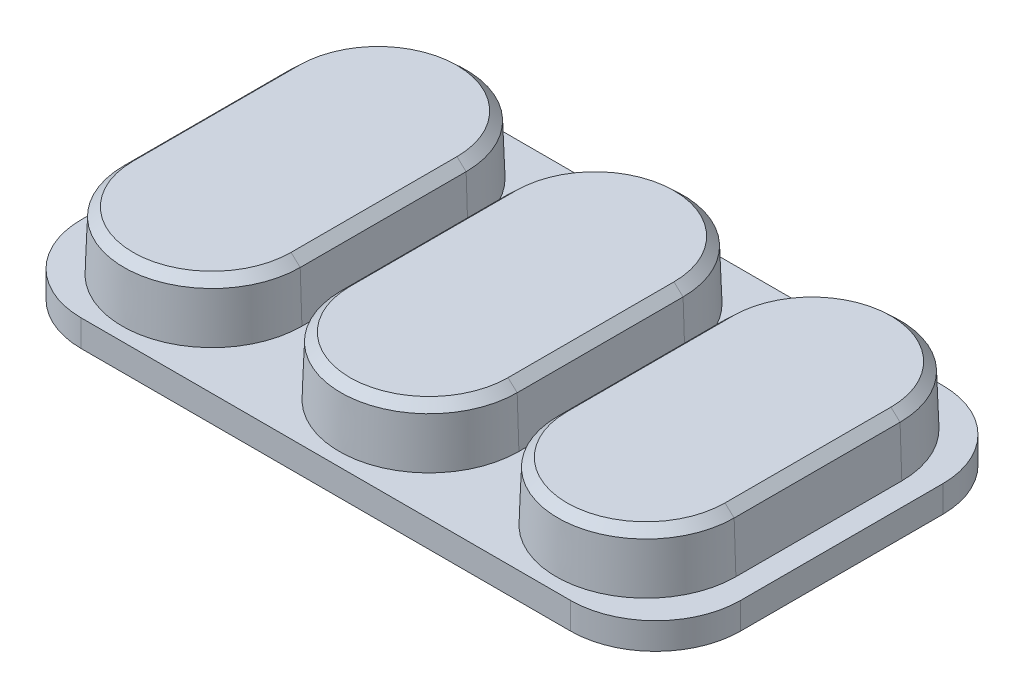
from build123d import *
from OCP.BRepFilletAPI import BRepFilletAPI_MakeChamfer

# Parameters (mm, degrees)
BOSS_EXTRUDE1_DEPTH = 2.5
BOSS_EXTRUDE2_DEPTH = 5.5
CHAMFER2_SIZE       = 5.5
CHAMFER2_SIZE_2     = 0.192064232
CHAMFER3_SIZE       = 0.8
CHAMFER3_SIZE2      = 0.829452764


with BuildPart() as part:
    # Sketch1 → Boss-Extrude1 (new body)
    with BuildSketch(Plane(origin=(0, 0, 0), x_dir=(1, 0, 0), z_dir=(0, 1, 0))):
        with BuildLine():
            Line((-23, 17.5), (23, 17.5))
            ThreePointArc((23, 17.5), (28.656854249, 15.156854249), (31, 9.5))
            Line((31, 9.5), (31, -9.5))
            ThreePointArc((31, -9.5), (28.656854249, -15.156854249), (23, -17.5))
            Line((23, -17.5), (-23, -17.5))
            ThreePointArc((-23, -17.5), (-28.656854249, -15.156854249), (-31, -9.5))
            Line((-31, -9.5), (-31, 9.5))
            ThreePointArc((-31, 9.5), (-28.656854249, 15.156854249), (-23, 17.5))
        make_face()
    extrude(amount=BOSS_EXTRUDE1_DEPTH)

    # Sketch2 → Boss-Extrude2 (add)
    with BuildSketch(Plane(origin=(0, 2.5, 0), x_dir=(1, 0, 0), z_dir=(0, 1, 0))):
        with BuildLine():
            Line((-28.85, -7.8), (-28.85, 7.8))
            ThreePointArc((-28.85, 7.8), (-20.4, 16.25), (-11.95, 7.8))
            Line((-11.95, 7.8), (-11.95, -7.8))
            ThreePointArc((-11.95, -7.8), (-20.4, -16.25), (-28.85, -7.8))
        make_face()
        with BuildLine():
            Line((-8.45, -7.8), (-8.45, 7.8))
            ThreePointArc((-8.45, 7.8), (0, 16.25), (8.45, 7.8))
            Line((8.45, 7.8), (8.45, -7.8))
            ThreePointArc((8.45, -7.8), (0, -16.25), (-8.45, -7.8))
        make_face()
        with BuildLine():
            Line((11.95, -7.8), (11.95, 7.8))
            ThreePointArc((11.95, 7.8), (20.4, 16.25), (28.85, 7.8))
            Line((28.85, 7.8), (28.85, -7.8))
            ThreePointArc((28.85, -7.8), (20.4, -16.25), (11.95, -7.8))
        make_face()
    extrude(amount=BOSS_EXTRUDE2_DEPTH)

    # Chamfer2
    # the kernel refuses this chamfer: 5.5, 0.192064232 mm, written as the material it takes off along each edge
    with BuildSketch(Plane(origin=(-28.85, 8, 7.8), x_dir=(-0.0013423185755924486, -0.9999990990900149, 0), z_dir=(0, 0, -1))) as chamfer2_piece_1_section:
        Polygon((CHAMFER2_SIZE * 0.99999909909, -CHAMFER2_SIZE * 0.00134231857559), (-CHAMFER2_SIZE_2 * 0.00134231857702, -CHAMFER2_SIZE_2 * 0.999999100155), (0, 0), align=None)
    chamfer2_piece_1 = extrude(amount=15.6, mode=Mode.PRIVATE)
    chamfer2_piece_1 = split(chamfer2_piece_1, bisect_by=Plane(origin=(-28.848299171, 2.5, 0), z_dir=(0, 1, 0)), keep=Keep.TOP, mode=Mode.PRIVATE)
    add(chamfer2_piece_1, mode=Mode.SUBTRACT)
    with BuildSketch(Plane(origin=(-20.4, 8, -7.8), x_dir=(-1, 0, 0), z_dir=(0, 0, 1))) as chamfer2_piece_2_section:
        Polygon((8.45, CHAMFER2_SIZE), (8.45 - CHAMFER2_SIZE_2 * 1.00000000107, 0), (8.45, 0), align=None)
    chamfer2_piece_2 = revolve(axis=Axis((-20.4, 8, -7.8), (0, -1, 0)), revolution_arc=180, mode=Mode.PRIVATE)
    chamfer2_piece_2 = split(chamfer2_piece_2, bisect_by=Plane(origin=(-20.4, 2.5, -16.18152008), z_dir=(0, 1, 0)), keep=Keep.TOP, mode=Mode.PRIVATE)
    add(chamfer2_piece_2, mode=Mode.SUBTRACT)
    with BuildSketch(Plane(origin=(-11.95, 8, -7.8), x_dir=(0.0013423185755924486, -0.9999990990900149, 0), z_dir=(0, 0, 1))) as chamfer2_piece_3_section:
        Polygon((CHAMFER2_SIZE * 0.99999909909, -CHAMFER2_SIZE * 0.00134231857559), (-CHAMFER2_SIZE_2 * 0.00134231857702, -CHAMFER2_SIZE_2 * 0.999999100155), (0, 0), align=None)
    chamfer2_piece_3 = extrude(amount=15.6, mode=Mode.PRIVATE)
    chamfer2_piece_3 = split(chamfer2_piece_3, bisect_by=Plane(origin=(-11.951700829, 2.5, 0), z_dir=(0, 1, 0)), keep=Keep.TOP, mode=Mode.PRIVATE)
    add(chamfer2_piece_3, mode=Mode.SUBTRACT)
    with BuildSketch(Plane(origin=(-20.4, 8, 7.8), x_dir=(1, 0, 0), z_dir=(0, 0, -1))) as chamfer2_piece_4_section:
        Polygon((8.45, CHAMFER2_SIZE), (8.45 - CHAMFER2_SIZE_2 * 1.00000000107, 0), (8.45, 0), align=None)
    chamfer2_piece_4 = revolve(axis=Axis((-20.4, 8, 7.8), (0, -1, 0)), revolution_arc=180, mode=Mode.PRIVATE)
    chamfer2_piece_4 = split(chamfer2_piece_4, bisect_by=Plane(origin=(-20.4, 2.5, 16.18152008), z_dir=(0, 1, 0)), keep=Keep.TOP, mode=Mode.PRIVATE)
    add(chamfer2_piece_4, mode=Mode.SUBTRACT)
    with BuildSketch(Plane(origin=(-8.45, 8, 7.8), x_dir=(-0.0013423185755924486, -0.9999990990900149, 0), z_dir=(0, 0, -1))) as chamfer2_piece_5_section:
        Polygon((CHAMFER2_SIZE * 0.99999909909, -CHAMFER2_SIZE * 0.00134231857559), (-CHAMFER2_SIZE_2 * 0.00134231857702, -CHAMFER2_SIZE_2 * 0.999999100155), (0, 0), align=None)
    chamfer2_piece_5 = extrude(amount=15.6, mode=Mode.PRIVATE)
    chamfer2_piece_5 = split(chamfer2_piece_5, bisect_by=Plane(origin=(-8.448299171, 2.5, 0), z_dir=(0, 1, 0)), keep=Keep.TOP, mode=Mode.PRIVATE)
    add(chamfer2_piece_5, mode=Mode.SUBTRACT)
    with BuildSketch(Plane(origin=(0, 8, -7.8), x_dir=(-1, 0, 0), z_dir=(0, 0, 1))) as chamfer2_piece_6_section:
        Polygon((8.45, CHAMFER2_SIZE), (8.45 - CHAMFER2_SIZE_2 * 1.00000000107, 0), (8.45, 0), align=None)
    chamfer2_piece_6 = revolve(axis=Axis((0, 8, -7.8), (0, -1, 0)), revolution_arc=180, mode=Mode.PRIVATE)
    chamfer2_piece_6 = split(chamfer2_piece_6, bisect_by=Plane(origin=(0, 2.5, -16.18152008), z_dir=(0, 1, 0)), keep=Keep.TOP, mode=Mode.PRIVATE)
    add(chamfer2_piece_6, mode=Mode.SUBTRACT)
    with BuildSketch(Plane(origin=(8.45, 8, -7.8), x_dir=(0.0013423185755924486, -0.9999990990900149, 0), z_dir=(0, 0, 1))) as chamfer2_piece_7_section:
        Polygon((CHAMFER2_SIZE * 0.99999909909, -CHAMFER2_SIZE * 0.00134231857559), (-CHAMFER2_SIZE_2 * 0.00134231857702, -CHAMFER2_SIZE_2 * 0.999999100155), (0, 0), align=None)
    chamfer2_piece_7 = extrude(amount=15.6, mode=Mode.PRIVATE)
    chamfer2_piece_7 = split(chamfer2_piece_7, bisect_by=Plane(origin=(8.448299171, 2.5, 0), z_dir=(0, 1, 0)), keep=Keep.TOP, mode=Mode.PRIVATE)
    add(chamfer2_piece_7, mode=Mode.SUBTRACT)
    with BuildSketch(Plane(origin=(0, 8, 7.8), x_dir=(1, 0, 0), z_dir=(0, 0, -1))) as chamfer2_piece_8_section:
        Polygon((8.45, CHAMFER2_SIZE), (8.45 - CHAMFER2_SIZE_2 * 1.00000000107, 0), (8.45, 0), align=None)
    chamfer2_piece_8 = revolve(axis=Axis((0, 8, 7.8), (0, -1, 0)), revolution_arc=180, mode=Mode.PRIVATE)
    chamfer2_piece_8 = split(chamfer2_piece_8, bisect_by=Plane(origin=(0, 2.5, 16.18152008), z_dir=(0, 1, 0)), keep=Keep.TOP, mode=Mode.PRIVATE)
    add(chamfer2_piece_8, mode=Mode.SUBTRACT)
    with BuildSketch(Plane(origin=(11.95, 8, 7.8), x_dir=(-0.0013423185755924486, -0.9999990990900149, 0), z_dir=(0, 0, -1))) as chamfer2_piece_9_section:
        Polygon((CHAMFER2_SIZE * 0.99999909909, -CHAMFER2_SIZE * 0.00134231857559), (-CHAMFER2_SIZE_2 * 0.00134231857702, -CHAMFER2_SIZE_2 * 0.999999100155), (0, 0), align=None)
    chamfer2_piece_9 = extrude(amount=15.6, mode=Mode.PRIVATE)
    chamfer2_piece_9 = split(chamfer2_piece_9, bisect_by=Plane(origin=(11.951700829, 2.5, 0), z_dir=(0, 1, 0)), keep=Keep.TOP, mode=Mode.PRIVATE)
    add(chamfer2_piece_9, mode=Mode.SUBTRACT)
    with BuildSketch(Plane(origin=(20.4, 8, -7.8), x_dir=(-1, 0, 0), z_dir=(0, 0, 1))) as chamfer2_piece_10_section:
        Polygon((8.45, CHAMFER2_SIZE), (8.45 - CHAMFER2_SIZE_2 * 1.00000000107, 0), (8.45, 0), align=None)
    chamfer2_piece_10 = revolve(axis=Axis((20.4, 8, -7.8), (0, -1, 0)), revolution_arc=180, mode=Mode.PRIVATE)
    chamfer2_piece_10 = split(chamfer2_piece_10, bisect_by=Plane(origin=(20.4, 2.5, -16.18152008), z_dir=(0, 1, 0)), keep=Keep.TOP, mode=Mode.PRIVATE)
    add(chamfer2_piece_10, mode=Mode.SUBTRACT)
    with BuildSketch(Plane(origin=(28.85, 8, -7.8), x_dir=(0.0013423185755924486, -0.9999990990900149, 0), z_dir=(0, 0, 1))) as chamfer2_piece_11_section:
        Polygon((CHAMFER2_SIZE * 0.99999909909, -CHAMFER2_SIZE * 0.00134231857559), (-CHAMFER2_SIZE_2 * 0.00134231857702, -CHAMFER2_SIZE_2 * 0.999999100155), (0, 0), align=None)
    chamfer2_piece_11 = extrude(amount=15.6, mode=Mode.PRIVATE)
    chamfer2_piece_11 = split(chamfer2_piece_11, bisect_by=Plane(origin=(28.848299171, 2.5, 0), z_dir=(0, 1, 0)), keep=Keep.TOP, mode=Mode.PRIVATE)
    add(chamfer2_piece_11, mode=Mode.SUBTRACT)
    with BuildSketch(Plane(origin=(20.4, 8, 7.8), x_dir=(1, 0, 0), z_dir=(0, 0, -1))) as chamfer2_piece_12_section:
        Polygon((8.45, CHAMFER2_SIZE), (8.45 - CHAMFER2_SIZE_2 * 1.00000000107, 0), (8.45, 0), align=None)
    chamfer2_piece_12 = revolve(axis=Axis((20.4, 8, 7.8), (0, -1, 0)), revolution_arc=180, mode=Mode.PRIVATE)
    chamfer2_piece_12 = split(chamfer2_piece_12, bisect_by=Plane(origin=(20.4, 2.5, 16.18152008), z_dir=(0, 1, 0)), keep=Keep.TOP, mode=Mode.PRIVATE)
    add(chamfer2_piece_12, mode=Mode.SUBTRACT)

    # Chamfer3: one chamfer whose edges measure the first distance from different faces: ONE call of the kernel's chamfer builder (chamfer() names one face for all edges)
    chamfer3_edges_1 = [part.edges().sort_by_distance(p)[0] for p in [
        (-20.4, 8, 16.057935768),
    ]]
    chamfer3_side_1 = [part.faces().sort_by_distance(p)[0] for p in [
        (-20.4, 5.25, 16.153967884),
    ]]
    chamfer3_edges_2 = [part.edges().sort_by_distance(p)[0] for p in [
        (-12.142064232, 8, 0),
    ]]
    chamfer3_side_2 = [part.faces().sort_by_distance(p)[0] for p in [
        (-12.046032116, 5.25, 0),
    ]]
    chamfer3_edges_3 = [part.edges().sort_by_distance(p)[0] for p in [
        (-20.4, 8, -16.057935768),
    ]]
    chamfer3_side_3 = [part.faces().sort_by_distance(p)[0] for p in [
        (-20.4, 5.25, -16.153967884),
    ]]
    chamfer3_edges_4 = [part.edges().sort_by_distance(p)[0] for p in [
        (-28.657935768, 8, 0),
    ]]
    chamfer3_side_4 = [part.faces().sort_by_distance(p)[0] for p in [
        (-28.753967884, 5.25, 0),
    ]]
    chamfer3_edges_5 = [part.edges().sort_by_distance(p)[0] for p in [
        (0, 8, 16.057935768),
    ]]
    chamfer3_side_5 = [part.faces().sort_by_distance(p)[0] for p in [
        (0, 5.25, 16.153967884),
    ]]
    chamfer3_edges_6 = [part.edges().sort_by_distance(p)[0] for p in [
        (8.257935768, 8, 0),
    ]]
    chamfer3_side_6 = [part.faces().sort_by_distance(p)[0] for p in [
        (8.353967884, 5.25, 0),
    ]]
    chamfer3_edges_7 = [part.edges().sort_by_distance(p)[0] for p in [
        (0, 8, -16.057935768),
    ]]
    chamfer3_side_7 = [part.faces().sort_by_distance(p)[0] for p in [
        (0, 5.25, -16.153967884),
    ]]
    chamfer3_edges_8 = [part.edges().sort_by_distance(p)[0] for p in [
        (-8.257935768, 8, 0),
    ]]
    chamfer3_side_8 = [part.faces().sort_by_distance(p)[0] for p in [
        (-8.353967884, 5.25, 0),
    ]]
    chamfer3_edges_9 = [part.edges().sort_by_distance(p)[0] for p in [
        (20.4, 8, 16.057935768),
    ]]
    chamfer3_side_9 = [part.faces().sort_by_distance(p)[0] for p in [
        (20.4, 5.25, 16.153967884),
    ]]
    chamfer3_edges_10 = [part.edges().sort_by_distance(p)[0] for p in [
        (28.657935768, 8, 0),
    ]]
    chamfer3_side_10 = [part.faces().sort_by_distance(p)[0] for p in [
        (28.753967884, 5.25, 0),
    ]]
    chamfer3_edges_11 = [part.edges().sort_by_distance(p)[0] for p in [
        (20.4, 8, -16.057935768),
    ]]
    chamfer3_side_11 = [part.faces().sort_by_distance(p)[0] for p in [
        (20.4, 5.25, -16.153967884),
    ]]
    chamfer3_edges_12 = [part.edges().sort_by_distance(p)[0] for p in [
        (12.142064232, 8, 0),
    ]]
    chamfer3_side_12 = [part.faces().sort_by_distance(p)[0] for p in [
        (12.046032116, 5.25, 0),
    ]]
    chamfer3 = BRepFilletAPI_MakeChamfer(part.part.solid().wrapped)
    for e in chamfer3_edges_1:
        chamfer3.Add(CHAMFER3_SIZE, CHAMFER3_SIZE2, e.wrapped, chamfer3_side_1[0].wrapped)  # the first distance lies on this face
    for e in chamfer3_edges_2:
        chamfer3.Add(CHAMFER3_SIZE, CHAMFER3_SIZE2, e.wrapped, chamfer3_side_2[0].wrapped)  # the first distance lies on this face
    for e in chamfer3_edges_3:
        chamfer3.Add(CHAMFER3_SIZE, CHAMFER3_SIZE2, e.wrapped, chamfer3_side_3[0].wrapped)  # the first distance lies on this face
    for e in chamfer3_edges_4:
        chamfer3.Add(CHAMFER3_SIZE, CHAMFER3_SIZE2, e.wrapped, chamfer3_side_4[0].wrapped)  # the first distance lies on this face
    for e in chamfer3_edges_5:
        chamfer3.Add(CHAMFER3_SIZE, CHAMFER3_SIZE2, e.wrapped, chamfer3_side_5[0].wrapped)  # the first distance lies on this face
    for e in chamfer3_edges_6:
        chamfer3.Add(CHAMFER3_SIZE, CHAMFER3_SIZE2, e.wrapped, chamfer3_side_6[0].wrapped)  # the first distance lies on this face
    for e in chamfer3_edges_7:
        chamfer3.Add(CHAMFER3_SIZE, CHAMFER3_SIZE2, e.wrapped, chamfer3_side_7[0].wrapped)  # the first distance lies on this face
    for e in chamfer3_edges_8:
        chamfer3.Add(CHAMFER3_SIZE, CHAMFER3_SIZE2, e.wrapped, chamfer3_side_8[0].wrapped)  # the first distance lies on this face
    for e in chamfer3_edges_9:
        chamfer3.Add(CHAMFER3_SIZE, CHAMFER3_SIZE2, e.wrapped, chamfer3_side_9[0].wrapped)  # the first distance lies on this face
    for e in chamfer3_edges_10:
        chamfer3.Add(CHAMFER3_SIZE, CHAMFER3_SIZE2, e.wrapped, chamfer3_side_10[0].wrapped)  # the first distance lies on this face
    for e in chamfer3_edges_11:
        chamfer3.Add(CHAMFER3_SIZE, CHAMFER3_SIZE2, e.wrapped, chamfer3_side_11[0].wrapped)  # the first distance lies on this face
    for e in chamfer3_edges_12:
        chamfer3.Add(CHAMFER3_SIZE, CHAMFER3_SIZE2, e.wrapped, chamfer3_side_12[0].wrapped)  # the first distance lies on this face
    add(Compound.cast(chamfer3.Shape()), mode=Mode.REPLACE)


solid = part.part
